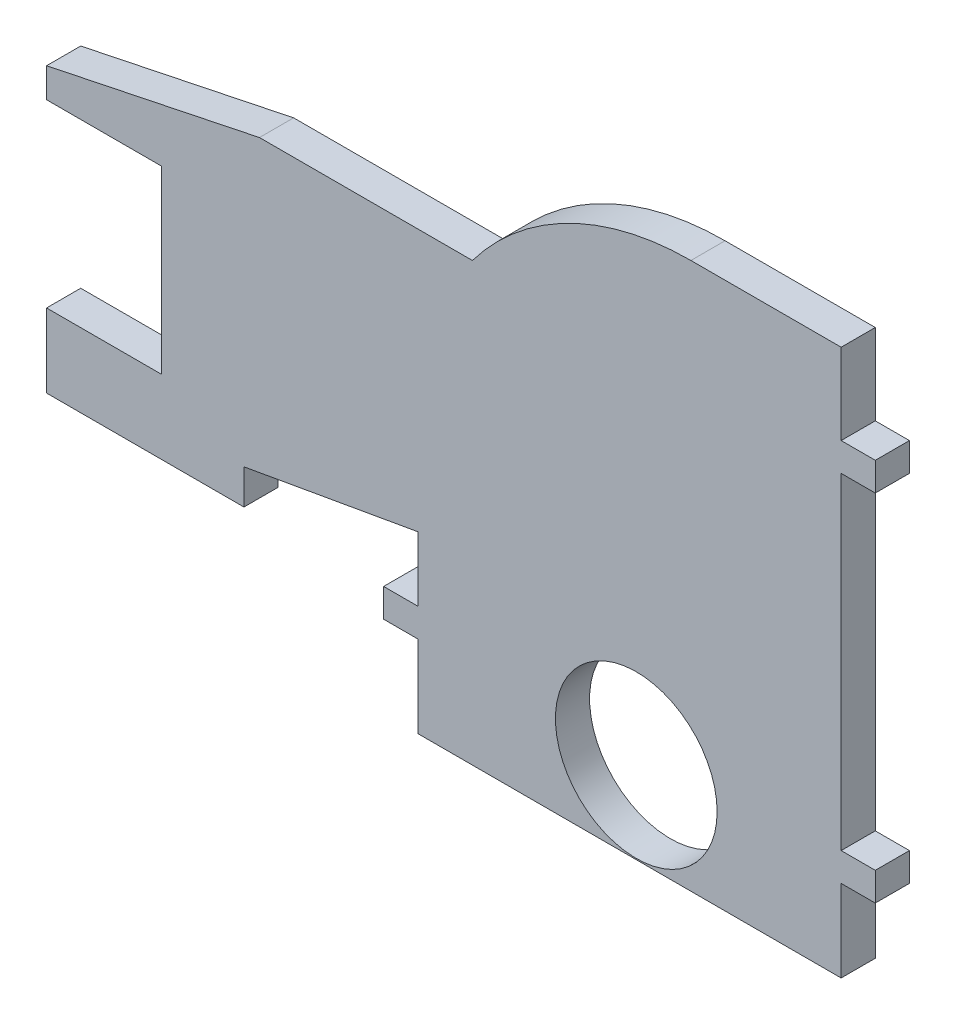
from build123d import *

# Parameters (mm, degrees)
SKETCH1_R           = 3.7592
BOSS_EXTRUDE1_DEPTH = 1.5875


with BuildPart() as part:
    # Sketch1 → Boss-Extrude1 (new body)
    with BuildSketch(Plane.XY):
        with BuildLine():
            Line((-18.241771939, 2.890724209), (-10.16, 4.318))
            Line((-10.16, 4.318), (-10.16, 1.3208))
            Line((-10.16, 1.3208), (-11.7475, 1.3208))
            Line((-11.7475, 1.3208), (-11.7475, 0))
            Line((-11.7475, 0), (-10.16, 0))
            Line((-10.16, 0), (-10.16, -3.81))
            Line((-10.16, -3.81), (9.525, -3.81))
            Line((9.525, -3.81), (9.525, 0))
            Line((9.525, 0), (11.1125, 0))
            Line((11.1125, 0), (11.1125, 1.3208))
            Line((11.1125, 1.3208), (9.525, 1.3208))
            Line((9.525, 1.3208), (9.525, 16.51))
            Line((9.525, 16.51), (11.1125, 16.51))
            Line((11.1125, 16.51), (11.1125, 17.8308))
            Line((11.1125, 17.8308), (9.525, 17.8308))
            Line((9.525, 17.8308), (9.525, 21.59))
            Line((9.525, 21.59), (2.54, 21.59))
            ThreePointArc((2.54, 21.59), (-3.139612663, 20.249225326), (-7.62, 16.51))
            Line((-7.62, 16.51), (-17.51946076, 16.51))
            Line((-17.51946076, 16.51), (-27.418921519, 14.4526))
            Line((-27.418921519, 14.4526), (-27.418921519, 13.081))
            Line((-27.418921519, 13.081), (-22.084921519, 13.081))
            Line((-22.084921519, 13.081), (-22.084921519, 4.699))
            Line((-22.084921519, 4.699), (-27.418921519, 4.699))
            Line((-27.418921519, 4.699), (-27.418921519, 1.27))
            Line((-27.418921519, 1.27), (-18.241771939, 1.27))
            Line((-18.241771939, 1.27), (-18.241771939, 2.890724209))
        make_face()
        Circle(SKETCH1_R, mode=Mode.SUBTRACT)
    extrude(amount=BOSS_EXTRUDE1_DEPTH)


solid = part.part
